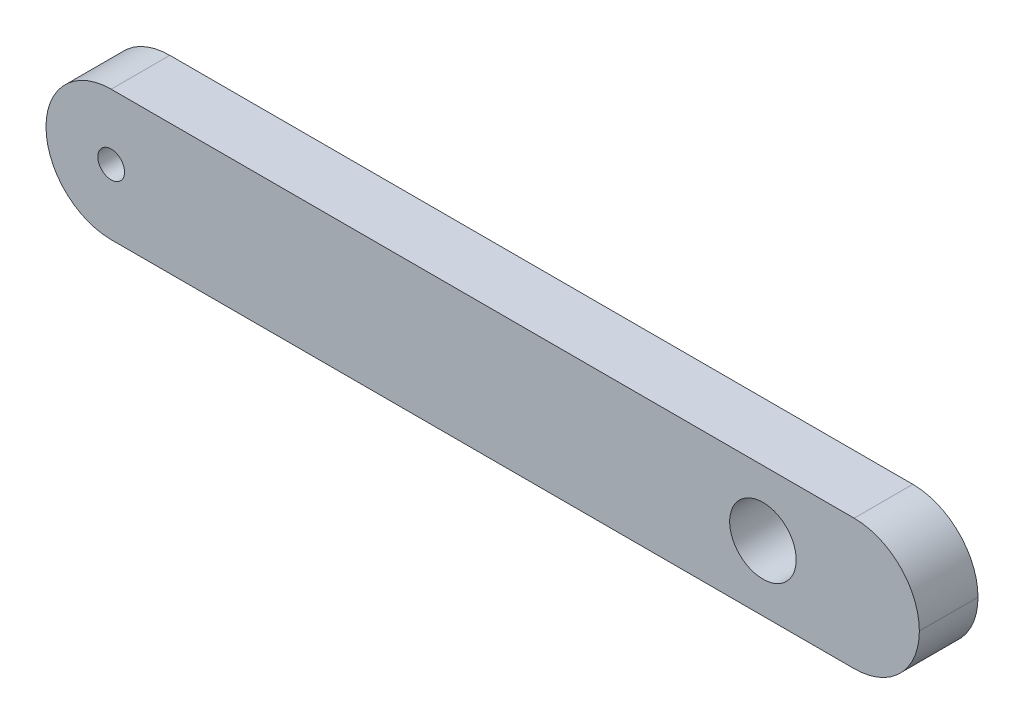
from build123d import *

# Parameters (mm, degrees)
SKETCH_1_W      = 67
SKETCH_1_H      = 10
SKETCH_1_R      = 1.025
SKETCH_1_R_2    = 2.55
EXTRUDE_1_DEPTH = 4.5
FILLET_1_R      = 5


with BuildPart() as part:
    # 草图1 → 凸台-拉伸1 (new body)
    with BuildSketch(Plane.XY):
        with Locations((33.5, -5)):
            Rectangle(SKETCH_1_W, SKETCH_1_H)
        with Locations((5, -5)):
            Circle(SKETCH_1_R, mode=Mode.SUBTRACT)
        with Locations((55, -5)):
            Circle(SKETCH_1_R_2, mode=Mode.SUBTRACT)
    extrude(amount=EXTRUDE_1_DEPTH)

    # 圆角1
    fillet_1_edges = [part.edges().sort_by_distance(p)[0] for p in [
        (0, -10, 2.25),
        (67, -10, 2.25),
        (67, 0, 2.25),
        (0, 0, 2.25),
    ]]
    fillet(fillet_1_edges, radius=FILLET_1_R - 0.0001)  # a hair under: the kernel refuses the full size


solid = part.part
